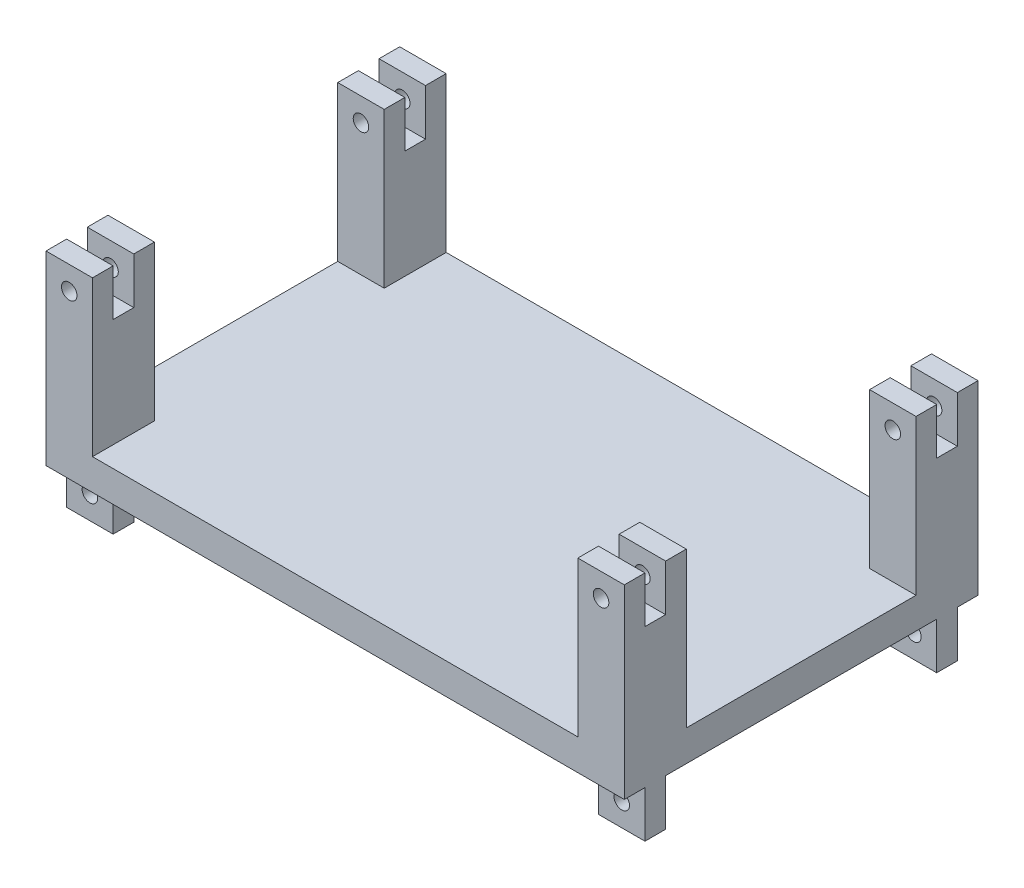
from build123d import *

# Parameters (mm, degrees)
SKETCH1_W           = 112
SKETCH1_H           = 34.25
BOSS_EXTRUDE2_DEPTH = 6
SKETCH3_W           = 9
SKETCH3_H           = 4
BOSS_EXTRUDE3_DEPTH = 9
SKETCH4_R           = 1.5
CUT_EXTRUDE1_DEPTH  = 117.361774222
SKETCH5_W           = 9
SKETCH5_H           = 12
BOSS_EXTRUDE4_DEPTH = 30
SKETCH6_W           = 9
SKETCH6_H           = 4
CUT_EXTRUDE2_DEPTH  = 9
SKETCH7_R           = 1.5
CUT_EXTRUDE3_DEPTH  = 12


with BuildPart() as part:
    # Sketch1 → Boss-Extrude2 (new body)
    with BuildSketch(Plane(origin=(0, 0, 0), x_dir=(1, 0, 0), z_dir=(0, 1, 0))):
        with Locations((-56, 17.125)):
            Rectangle(SKETCH1_W, SKETCH1_H)
    boss_extrude2 = extrude(amount=BOSS_EXTRUDE2_DEPTH)

    # Sketch3 → Boss-Extrude3 (add)
    with BuildSketch(Plane.XZ):
        with Locations((-107.5, -6)):
            Rectangle(SKETCH3_W, SKETCH3_H)
        with Locations((-4.5, -6)):
            Rectangle(SKETCH3_W, SKETCH3_H)
    boss_extrude3 = extrude(amount=BOSS_EXTRUDE3_DEPTH)

    # Sketch4 → Cut-Extrude1 (cut, through all)
    with BuildSketch(Plane.XY.offset(-4)):
        with Locations((-107.5, -4.5)):
            Circle(SKETCH4_R)
        with Locations((-4.5, -4.5)):
            Circle(SKETCH4_R)
    cut_extrude1 = extrude(amount=-CUT_EXTRUDE1_DEPTH, mode=Mode.SUBTRACT)

    # Sketch5 → Boss-Extrude4 (add)
    with BuildSketch(Plane(origin=(0, 6, 0), x_dir=(1, 0, 0), z_dir=(0, 1, 0))):
        with Locations((-107.5, 6)):
            Rectangle(SKETCH5_W, SKETCH5_H)
        with Locations((-4.5, 6)):
            Rectangle(SKETCH5_W, SKETCH5_H)
    boss_extrude4 = extrude(amount=BOSS_EXTRUDE4_DEPTH)

    # Sketch6 → Cut-Extrude2 (cut)
    with BuildSketch(Plane(origin=(0, 36, 0), x_dir=(1, 0, 0), z_dir=(0, 1, 0))):
        with Locations((-107.5, 6)):
            Rectangle(SKETCH6_W, SKETCH6_H)
        with Locations((-4.5, 6)):
            Rectangle(SKETCH6_W, SKETCH6_H)
    cut_extrude2 = extrude(amount=-CUT_EXTRUDE2_DEPTH, mode=Mode.SUBTRACT)

    # Sketch7 → Cut-Extrude3 (cut)
    with BuildSketch(Plane.XY):
        with Locations((-107.5, 31.5)):
            Circle(SKETCH7_R)
        with Locations((-4.5, 31.5)):
            Circle(SKETCH7_R)
    cut_extrude3 = extrude(amount=-CUT_EXTRUDE3_DEPTH, mode=Mode.SUBTRACT)

    # Mirror1: Boss-Extrude2, Boss-Extrude3, Cut-Extrude1, Boss-Extrude4, Cut-Extrude2, Cut-Extrude3 across plane
    add(boss_extrude2.mirror(Plane(origin=(0, 6, -34.25), x_dir=(1, 0, 0), z_dir=(0, 0, 1))))
    add(boss_extrude3.mirror(Plane(origin=(0, 6, -34.25), x_dir=(1, 0, 0), z_dir=(0, 0, 1))))
    add(cut_extrude1.mirror(Plane(origin=(0, 6, -34.25), x_dir=(1, 0, 0), z_dir=(0, 0, 1))), mode=Mode.SUBTRACT)
    add(boss_extrude4.mirror(Plane(origin=(0, 6, -34.25), x_dir=(1, 0, 0), z_dir=(0, 0, 1))))
    add(cut_extrude2.mirror(Plane(origin=(0, 6, -34.25), x_dir=(1, 0, 0), z_dir=(0, 0, 1))), mode=Mode.SUBTRACT)
    add(cut_extrude3.mirror(Plane(origin=(0, 6, -34.25), x_dir=(1, 0, 0), z_dir=(0, 0, 1))), mode=Mode.SUBTRACT)


solid = part.part
